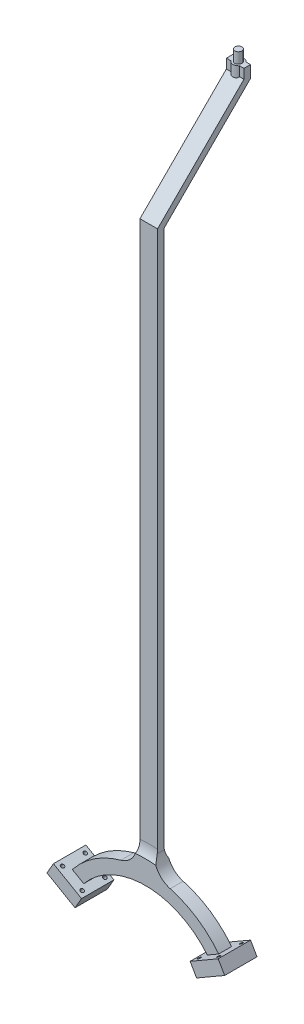
from build123d import *

# Parameters (mm, degrees)
SKETCH1_R                = 8.2
BOSS_EXTRUDE1_DEPTH      = 25
SKETCH2_W                = 40.79
SKETCH2_H                = 15
BOSS_EXTRUDE2_DEPTH      = 25
SKETCH3_R                = 12.5
BOSS_EXTRUDE4_DEPTH      = 25
BOSS_EXTRUDE5_REACH      = 51.448
SKETCH5_W                = 40.79
SKETCH5_H                = 15
BOSS_EXTRUDE7_DEPTH      = 1505
BOSS_EXTRUDE8_START      = -40.79
BOSS_EXTRUDE8_DEPTH      = 40.79
SKETCH9_W                = 15
SKETCH9_H                = 15
REVOLVE1_ANGLE           = 60
REVOLVE1_OTHER_WAY_ANGLE = 60
FILLET3_R                = 50
SKETCH11_W               = 75
SKETCH11_H               = 75
SKETCH11_R               = 4
BOSS_EXTRUDE9_DEPTH      = 30
CUT_EXTRUDE2_DEPTH       = 1755.203433898


with BuildPart() as part:
    # Sketch1 → Boss-Extrude1 (new body)
    with BuildSketch(Plane(origin=(0, 0, 0), x_dir=(1, 0, 0), z_dir=(0, 1, 0))):
        with Locations(Location((0, 0, 0), (0, 0, 270))):
            Circle(SKETCH1_R)
    extrude(amount=BOSS_EXTRUDE1_DEPTH)

    # Sketch2 → Boss-Extrude2 (add)
    with BuildSketch(Plane(origin=(0, 0, 0), x_dir=(-1, 0, 0), z_dir=(0, -1, 0))):
        Rectangle(SKETCH2_W, SKETCH2_H)
    extrude(amount=BOSS_EXTRUDE2_DEPTH)

    # Sketch3 → Boss-Extrude4 (add)
    with BuildSketch(Plane(origin=(0, -25, 0), x_dir=(-1, 0, 0), z_dir=(0, -1, 0))):
        Circle(SKETCH3_R)
    extrude(amount=-BOSS_EXTRUDE4_DEPTH)

    # Boss-Extrude5: up to this face of the body (flat: up to its plane)
    boss_extrude5_end = Plane(part.part.faces().sort_by_distance((20.395, -12.5, 0))[0])
    # Sketch4 → Boss-Extrude5 (add, up to the picked face)
    with BuildSketch(Plane.ZY.offset(20.395), mode=Mode.PRIVATE) as boss_extrude5_sk1:
        Polygon((192.5, -225), (-7.5, -25), (7.5, -25), (207.5, -225), align=None)
    boss_extrude5_tool1 = split(extrude(boss_extrude5_sk1.sketch, amount=-BOSS_EXTRUDE5_REACH, mode=Mode.PRIVATE), bisect_by=boss_extrude5_end, keep=Keep.BOTH, mode=Mode.PRIVATE)
    add(boss_extrude5_tool1.solids().sort_by(Axis((-20.395, -125, 100), (1, 0, 0)))[0])

    # Sketch5 → Boss-Extrude7 (add)
    with BuildSketch(Plane(origin=(0, -225, 0), x_dir=(-1, 0, 0), z_dir=(0, -1, 0))):
        with Locations((0, -200)):
            Rectangle(SKETCH5_W, SKETCH5_H)
    extrude(amount=BOSS_EXTRUDE7_DEPTH)

    # Sketch7 → Boss-Extrude8 (add)
    with BuildSketch(Plane(origin=(20.395, 0, 0), x_dir=(0, 0, -1), z_dir=(1, 0, 0)).offset(BOSS_EXTRUDE8_START)):
        Polygon((1.552099385, -34.052099385), (0, -32.5), (-192.5, -225), (-192.5, -228.104198769), align=None)
        Polygon((7.5, -25), (0, -32.5), (1.552099385, -34.052099385), (7.5, -28.104198769), align=None)
        Polygon((-9.052099385, -23.447900615), (-207.5, -221.895801231), (-207.5, -225), (-7.5, -25), align=None)
        Polygon((-9.052099385, -23.447900615), (-7.5, -25), (-7.5, -21.895801231), align=None)
    extrude(amount=BOSS_EXTRUDE8_DEPTH)

    # Sketch9 → Revolve1 (revolve)
    with BuildSketch(Plane(origin=(0, 0, 0), x_dir=(0, 0, -1), z_dir=(1, 0, 0))):
        with Locations((-207.5, -1522.5)):
            Rectangle(SKETCH9_W, SKETCH9_H)
        Polygon((-185, -1545), (-185, -1530), (-200, -1530), (-215, -1530), (-215, -1545), align=None)
        with Locations((-192.5, -1522.5)):
            Rectangle(SKETCH9_W, SKETCH9_H)
    revolve(axis=Axis((0, -1730, 192.5), (0, 0, 1)), revolution_arc=REVOLVE1_ANGLE)

    # Sketch9 → Revolve1 other way (revolve)
    with BuildSketch(Plane(origin=(0, 0, 0), x_dir=(0, 0, -1), z_dir=(1, 0, 0))):
        with Locations((-207.5, -1522.5)):
            Rectangle(SKETCH9_W, SKETCH9_H)
        Polygon((-185, -1545), (-185, -1530), (-200, -1530), (-215, -1530), (-215, -1545), align=None)
        with Locations((-192.5, -1522.5)):
            Rectangle(SKETCH9_W, SKETCH9_H)
    revolve(axis=Axis((0, -1730, 192.5), (0, 0, -1)), revolution_arc=REVOLVE1_OTHER_WAY_ANGLE)

    # Fillet3
    # the kernel refuses this fillet: 50 mm, written as the material it adds along each edge
    with BuildSketch(Plane(origin=(0, -1730, 207.5), x_dir=(0.6259913130832682, 0.7798300301631668, 0), z_dir=(0.7798300301631668, -0.6259913130832682, 0))) as fillet3_piece_1_section:
        with BuildLine():
            CenterArc((215 + FILLET3_R, FILLET3_R), FILLET3_R, 180, 90)
            Line((215, FILLET3_R), (215, 0))
            Line((215, 0), (215 + FILLET3_R, 0))
        make_face()
    fillet3_piece_1 = revolve(axis=Axis((0, -1730, 207.5), (0, 0, 1)), revolution_arc=77.509968484, mode=Mode.PRIVATE)
    fillet3_piece_1 = split(fillet3_piece_1, bisect_by=Plane(origin=(20.395, -1497.728593149, 210.201005202), z_dir=(-1, 0, 0)), keep=Keep.TOP, mode=Mode.PRIVATE)
    fillet3_piece_1 = split(fillet3_piece_1, bisect_by=Plane(origin=(-20.395, -1497.728593149, 210.201005202), z_dir=(1, 0, 0)), keep=Keep.TOP, mode=Mode.PRIVATE)
    fillet3_piece_1 = split(fillet3_piece_1, bisect_by=Plane(origin=(0, -1497.728593149, 215), z_dir=(0, 0, -1)), keep=Keep.TOP, mode=Mode.PRIVATE)
    add(fillet3_piece_1)
    with BuildSketch(Plane(origin=(-20.395, -1515.969525593, 192.5), x_dir=(-0.9834951946600375, -0.1809342479482942, 0), z_dir=(0, 0, 1))) as fillet3_piece_2:
        with BuildLine():
            CenterArc((41.675293239, -49.811185367), FILLET3_R, 94.980893043, 74.594925131)
            Line((-7.499466494, -40.764472969), (0, 0))
            ThreePointArc((0, 0), (18.66705843, -0.811902923), (37.33411686, 0))
        make_face()
    extrude(amount=15)
    with BuildSketch(Plane(origin=(0, -1730, 192.5), x_dir=(0.6259913130832687, 0.7798300301631664, 0), z_dir=(0.7798300301631664, -0.6259913130832687, 0))) as fillet3_piece_3_section:
        with BuildLine():
            CenterArc((215 + FILLET3_R, -FILLET3_R), FILLET3_R, 90, 90)
            Line((215 + FILLET3_R, 0), (215, 0))
            Line((215, 0), (215, -FILLET3_R))
        make_face()
    fillet3_piece_3 = revolve(axis=Axis((0, -1730, 192.5), (0, 0, 1)), revolution_arc=77.509968484, mode=Mode.PRIVATE)
    fillet3_piece_3 = split(fillet3_piece_3, bisect_by=Plane(origin=(0, -1497.728593149, 185), z_dir=(0, 0, 1)), keep=Keep.TOP, mode=Mode.PRIVATE)
    fillet3_piece_3 = split(fillet3_piece_3, bisect_by=Plane(origin=(-20.395, -1497.728593149, 189.798994798), z_dir=(1, 0, 0)), keep=Keep.TOP, mode=Mode.PRIVATE)
    fillet3_piece_3 = split(fillet3_piece_3, bisect_by=Plane(origin=(20.395, -1497.728593149, 189.798994798), z_dir=(-1, 0, 0)), keep=Keep.TOP, mode=Mode.PRIVATE)
    add(fillet3_piece_3)
    with BuildSketch(Plane(origin=(20.395, -1515.969525593, 192.5), x_dir=(0.9834951946600374, -0.18093424794829469, 0), z_dir=(0, 0, 1))) as fillet3_piece_4:
        with BuildLine():
            CenterArc((41.675293239, 49.811185367), FILLET3_R, 190.424181826, 74.594925131)
            Line((-7.499466494, 40.764472969), (0, 0))
            ThreePointArc((0, 0), (18.66705843, 0.811902923), (37.33411686, 0))
        make_face()
    extrude(amount=15)
    with BuildSketch(Plane(origin=(0, -1730, 207.5), x_dir=(0.6259913130832682, 0.7798300301631668, 0), z_dir=(0.7798300301631668, -0.6259913130832682, 0))) as fillet3_piece_5a_section:
        with BuildLine():
            CenterArc((215 + FILLET3_R, FILLET3_R), FILLET3_R, 180, 90)
            Line((215, FILLET3_R), (215, 0))
            Line((215, 0), (215 + FILLET3_R, 0))
        make_face()
    fillet3_piece_5a = revolve(axis=Axis((0, -1730, 207.5), (0, 0, 1)), revolution_arc=77.509968484, mode=Mode.PRIVATE)
    fillet3_piece_5a = split(fillet3_piece_5a, bisect_by=Plane(origin=(20.395, -1516.663886588, 210.150724115), z_dir=(1, 0, 0)), keep=Keep.TOP, mode=Mode.PRIVATE)
    fillet3_piece_5a = split(fillet3_piece_5a, bisect_by=Plane(origin=(85.698064456, -1516.663886588, 215), z_dir=(0, 0, -1)), keep=Keep.TOP, mode=Mode.PRIVATE)
    with BuildSketch(Plane(origin=(20.395, -1515.969525593, 192.5), x_dir=(0.9834951946600374, -0.18093424794829469, 0), z_dir=(0, 0, 1))) as fillet3_piece_5b_section:
        with BuildLine():
            CenterArc((41.675293239, 49.811185367), FILLET3_R, 190.424181826, 74.594925131)
            Line((-7.499466494, 40.764472969), (0, 0))
            ThreePointArc((0, 0), (18.66705843, 0.811902923), (37.33411686, 0))
        make_face()
    fillet3_piece_5b = extrude(amount=118.621434021, mode=Mode.PRIVATE)
    fillet3_piece_5b = split(fillet3_piece_5b, bisect_by=Plane(origin=(28.539652215, -1507.603520272, 207.5), z_dir=(0, 0, 1)), keep=Keep.TOP, mode=Mode.PRIVATE)
    fillet3_piece_5b = split(fillet3_piece_5b, bisect_by=Plane(origin=(28.539652215, -1507.603520272, 215), z_dir=(0, 0, -1)), keep=Keep.TOP, mode=Mode.PRIVATE)
    fillet3_piece_5 = fillet3_piece_5a & fillet3_piece_5b
    add(fillet3_piece_5)
    with BuildSketch(Plane(origin=(0, -1730, 207.5), x_dir=(0.6259913130832682, 0.7798300301631668, 0), z_dir=(0.7798300301631668, -0.6259913130832682, 0))) as fillet3_piece_6a_section:
        with BuildLine():
            CenterArc((215 + FILLET3_R, FILLET3_R), FILLET3_R, 180, 90)
            Line((215, FILLET3_R), (215, 0))
            Line((215, 0), (215 + FILLET3_R, 0))
        make_face()
    fillet3_piece_6a = revolve(axis=Axis((0, -1730, 207.5), (0, 0, 1)), revolution_arc=77.509968484, mode=Mode.PRIVATE)
    fillet3_piece_6a = split(fillet3_piece_6a, bisect_by=Plane(origin=(-20.395, -1516.663887252, 210.150724175), z_dir=(-1, 0, 0)), keep=Keep.TOP, mode=Mode.PRIVATE)
    fillet3_piece_6a = split(fillet3_piece_6a, bisect_by=Plane(origin=(-85.69806423, -1516.663887252, 215), z_dir=(0, 0, -1)), keep=Keep.TOP, mode=Mode.PRIVATE)
    with BuildSketch(Plane(origin=(-20.395, -1515.969525593, 192.5), x_dir=(-0.9834951946600375, -0.1809342479482942, 0), z_dir=(0, 0, 1))) as fillet3_piece_6b_section:
        with BuildLine():
            CenterArc((41.675293239, -49.811185367), FILLET3_R, 94.980893043, 74.594925131)
            Line((-7.499466494, -40.764472969), (0, 0))
            ThreePointArc((0, 0), (18.66705843, -0.811902923), (37.33411686, 0))
        make_face()
    fillet3_piece_6b = extrude(amount=118.621434021, mode=Mode.PRIVATE)
    fillet3_piece_6b = split(fillet3_piece_6b, bisect_by=Plane(origin=(-28.539652215, -1507.603520272, 207.5), z_dir=(0, 0, 1)), keep=Keep.TOP, mode=Mode.PRIVATE)
    fillet3_piece_6b = split(fillet3_piece_6b, bisect_by=Plane(origin=(-28.539652215, -1507.603520272, 215), z_dir=(0, 0, -1)), keep=Keep.TOP, mode=Mode.PRIVATE)
    fillet3_piece_6 = fillet3_piece_6a & fillet3_piece_6b
    add(fillet3_piece_6)
    with BuildSketch(Plane(origin=(0, -1730, 192.5), x_dir=(0.6259913130832687, 0.7798300301631664, 0), z_dir=(0.7798300301631664, -0.6259913130832687, 0))) as fillet3_piece_7a_section:
        with BuildLine():
            CenterArc((215 + FILLET3_R, -FILLET3_R), FILLET3_R, 90, 90)
            Line((215 + FILLET3_R, 0), (215, 0))
            Line((215, 0), (215, -FILLET3_R))
        make_face()
    fillet3_piece_7a = revolve(axis=Axis((0, -1730, 192.5), (0, 0, 1)), revolution_arc=77.509968484, mode=Mode.PRIVATE)
    fillet3_piece_7a = split(fillet3_piece_7a, bisect_by=Plane(origin=(-85.69806423, -1516.663887252, 185), z_dir=(0, 0, 1)), keep=Keep.TOP, mode=Mode.PRIVATE)
    fillet3_piece_7a = split(fillet3_piece_7a, bisect_by=Plane(origin=(-20.395, -1516.663887252, 189.849275825), z_dir=(-1, 0, 0)), keep=Keep.TOP, mode=Mode.PRIVATE)
    with BuildSketch(Plane(origin=(-20.395, -1515.969525593, 88.878565979), x_dir=(-0.9834951946600375, -0.1809342479482942, 0), z_dir=(0, 0, 1))) as fillet3_piece_7b_section:
        with BuildLine():
            CenterArc((41.675293239, -49.811185367), FILLET3_R, 94.980893043, 74.594925131)
            Line((-7.499466494, -40.764472969), (0, 0))
            ThreePointArc((0, 0), (18.66705843, -0.811902923), (37.33411686, 0))
        make_face()
    fillet3_piece_7b = extrude(amount=118.621434021, mode=Mode.PRIVATE)
    fillet3_piece_7b = split(fillet3_piece_7b, bisect_by=Plane(origin=(-28.539652215, -1507.603520272, 185), z_dir=(0, 0, 1)), keep=Keep.TOP, mode=Mode.PRIVATE)
    fillet3_piece_7b = split(fillet3_piece_7b, bisect_by=Plane(origin=(-28.539652215, -1507.603520272, 192.5), z_dir=(0, 0, -1)), keep=Keep.TOP, mode=Mode.PRIVATE)
    fillet3_piece_7 = fillet3_piece_7a & fillet3_piece_7b
    add(fillet3_piece_7)
    with BuildSketch(Plane(origin=(0, -1730, 192.5), x_dir=(0.6259913130832687, 0.7798300301631664, 0), z_dir=(0.7798300301631664, -0.6259913130832687, 0))) as fillet3_piece_8a_section:
        with BuildLine():
            CenterArc((215 + FILLET3_R, -FILLET3_R), FILLET3_R, 90, 90)
            Line((215 + FILLET3_R, 0), (215, 0))
            Line((215, 0), (215, -FILLET3_R))
        make_face()
    fillet3_piece_8a = revolve(axis=Axis((0, -1730, 192.5), (0, 0, 1)), revolution_arc=77.509968484, mode=Mode.PRIVATE)
    fillet3_piece_8a = split(fillet3_piece_8a, bisect_by=Plane(origin=(85.698064456, -1516.663886588, 185), z_dir=(0, 0, 1)), keep=Keep.TOP, mode=Mode.PRIVATE)
    fillet3_piece_8a = split(fillet3_piece_8a, bisect_by=Plane(origin=(20.395, -1516.663886588, 189.849275885), z_dir=(1, 0, 0)), keep=Keep.TOP, mode=Mode.PRIVATE)
    with BuildSketch(Plane(origin=(20.395, -1515.969525593, 88.878565979), x_dir=(0.9834951946600374, -0.1809342479482948, 0), z_dir=(0, 0, 1))) as fillet3_piece_8b_section:
        with BuildLine():
            CenterArc((41.675293239, 49.811185367), FILLET3_R, 190.424181826, 74.594925131)
            Line((-7.499466494, 40.764472969), (0, 0))
            ThreePointArc((0, 0), (18.66705843, 0.811902923), (37.33411686, 0))
        make_face()
    fillet3_piece_8b = extrude(amount=118.621434021, mode=Mode.PRIVATE)
    fillet3_piece_8b = split(fillet3_piece_8b, bisect_by=Plane(origin=(28.539652215, -1507.603520272, 185), z_dir=(0, 0, 1)), keep=Keep.TOP, mode=Mode.PRIVATE)
    fillet3_piece_8b = split(fillet3_piece_8b, bisect_by=Plane(origin=(28.539652215, -1507.603520272, 192.5), z_dir=(0, 0, -1)), keep=Keep.TOP, mode=Mode.PRIVATE)
    fillet3_piece_8 = fillet3_piece_8a & fillet3_piece_8b
    add(fillet3_piece_8)

    # Sketch11 → Boss-Extrude9 (add)
    with BuildSketch(Plane(origin=(749.111974274, -1297.5, 0), x_dir=(-0.8660254037844398, -0.49999999999999806, 0), z_dir=(0.499999999999998, -0.8660254037844397, 0))):
        with Locations((665, -200)):
            Rectangle(SKETCH11_W, SKETCH11_H)
        with Locations(Location((638.75, -173.75, 0), (0, 0, 180))):
            Circle(SKETCH11_R, mode=Mode.SUBTRACT)
        with Locations(Location((691.25, -173.75, 0), (0, 0, 180))):
            Circle(SKETCH11_R, mode=Mode.SUBTRACT)
        with Locations(Location((691.25, -226.25, 0), (0, 0, 180))):
            Circle(SKETCH11_R, mode=Mode.SUBTRACT)
        with Locations(Location((638.75, -226.25, 0), (0, 0, 180))):
            Circle(SKETCH11_R, mode=Mode.SUBTRACT)
    boss_extrude9 = extrude(amount=-BOSS_EXTRUDE9_DEPTH)

    # Mirror1: Boss-Extrude9 across plane
    add(boss_extrude9.mirror(Plane(origin=(0, 0, 0), x_dir=(0, 0, 1), z_dir=(1, 0, 0))))

    # Sketch15 → Cut-Extrude2 (cut, through all)
    with BuildSketch(Plane(origin=(0, 0, 192.5), x_dir=(-1, 0, 0), z_dir=(0, 0, -1))):
        with BuildLine():
            Line((-20.395, -1730), (-20.395, -1546.127642167))
            ThreePointArc((-20.395, -1546.127642167), (0, -1545), (20.395, -1546.127642167))
            Line((20.395, -1546.127642167), (20.395, -1730))
            Line((20.395, -1730), (-20.395, -1730))
        make_face()
    extrude(amount=-CUT_EXTRUDE2_DEPTH, mode=Mode.SUBTRACT)


solid = part.part
